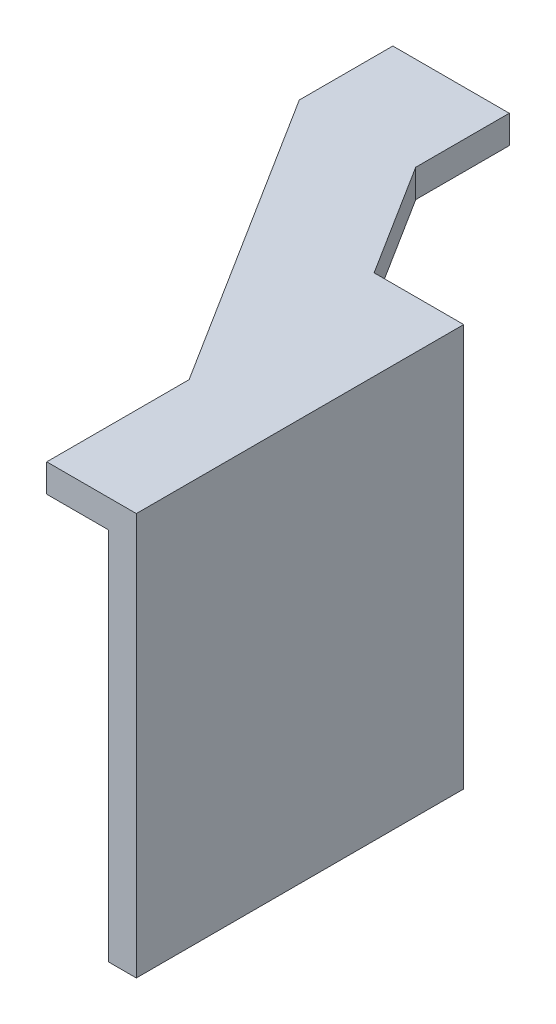
from build123d import *

# Parameters (mm, degrees)
BOSS_EXTRUDE1_DEPTH = 3
SKETCH3_W           = 3
SKETCH3_H           = 35
BOSS_EXTRUDE2_DEPTH = 40
BOSS_EXTRUDE3_DEPTH = 3
CUT_EXTRUDE3_DEPTH  = 6.5


with BuildPart() as part:
    # Sketch1 → Boss-Extrude1 (new body)
    with BuildSketch(Plane(origin=(0, 0, 0), x_dir=(1, 0, 0), z_dir=(0, 1, 0))):
        Polygon((10, -5), (10, -52), (19.57850172, -52), (19.57850172, 5), (10, 5), (-10, 5), (-10, -5), align=None)
    extrude(amount=BOSS_EXTRUDE1_DEPTH)

    # Sketch3 → Boss-Extrude2 (add)
    with BuildSketch(Plane.XZ):
        with Locations((18.07850172, 34.5)):
            Rectangle(SKETCH3_W, SKETCH3_H)
    extrude(amount=BOSS_EXTRUDE2_DEPTH)

    # Sketch4 → Boss-Extrude3 (add)
    with BuildSketch(Plane(origin=(0, 0, 0), x_dir=(1, 0, 0), z_dir=(0, 1, 0))):
        Polygon((-10, 5), (-10, -5), (19.57850172, -52), (19.57850172, -17), (10, -17), (2.448042114, -5), (2.448042114, 5), align=None)
    extrude(amount=BOSS_EXTRUDE3_DEPTH)

    # Sketch5 → Cut-Extrude3 (cut, symmetric)
    with BuildSketch(Plane(origin=(0, 0, 0), x_dir=(1, 0, 0), z_dir=(0, 1, 0))):
        Polygon((2.448042114, 5), (19.57850172, 5), (19.57850172, -17), (10, -17), (2.448042114, -5), align=None)
    extrude(amount=CUT_EXTRUDE3_DEPTH, both=True, mode=Mode.SUBTRACT)


solid = part.part
